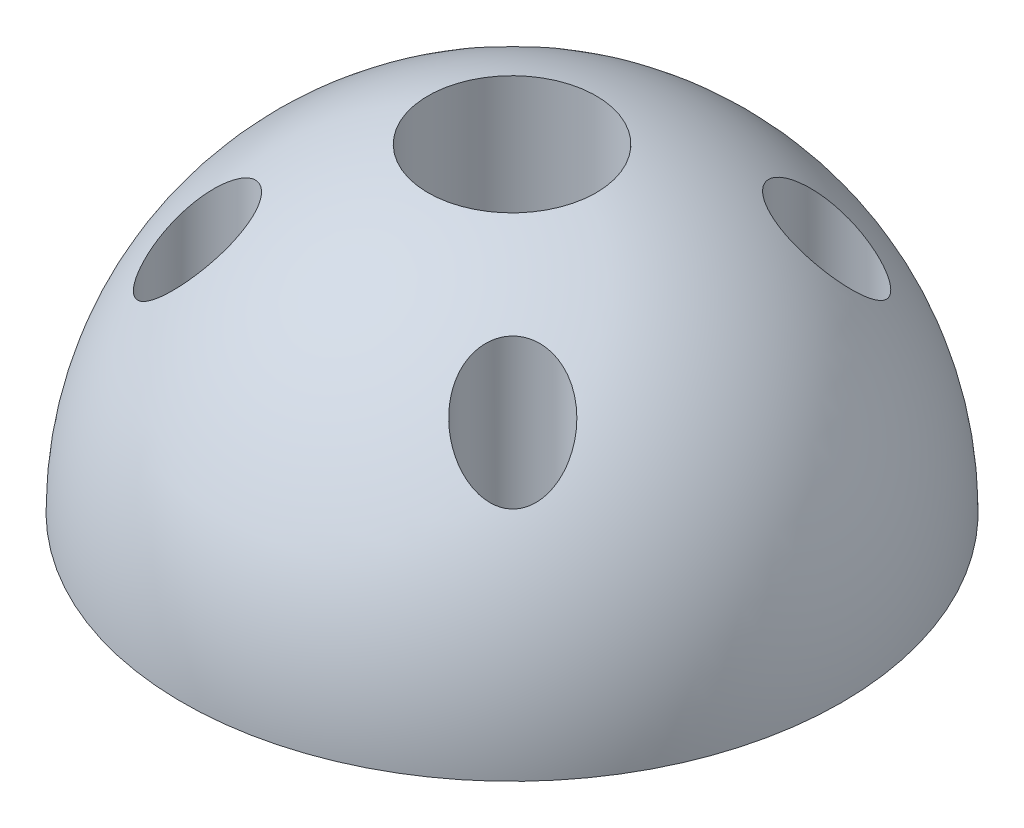
from build123d import *

# Parameters (mm, degrees)
CUT_EXTRUDE2_DEPTH = 3.5
SKETCH7_R          = 1.5
CUT_EXTRUDE6_DEPTH = 7
SKETCH3_R          = 5.1
CUT_EXTRUDE7_DEPTH = 33.74522866
CUT_EXTRUDE8_START = 4
SKETCH8_R          = 2.75
CUT_EXTRUDE8_DEPTH = 31.263537471


with BuildPart() as part:
    # Sketch1 → Revolve1 (revolve)
    with BuildSketch(Plane.XY):
        with BuildLine():
            ThreePointArc((0, 20), (-14.142135624, 14.142135624), (-20, 0))
            Line((-20, 0), (0, 0))
            Line((0, 0), (0, 20))
        make_face()
    revolve(axis=Axis((0, -1000, 0), (0, 1, 0)))

    # Sketch2 → Cut-Extrude2 (cut)
    with BuildSketch(Plane.XZ):
        Polygon((4.878609775, -8.45), (9.757219549, 0), (4.878609775, 8.45), (-4.878609775, 8.45), (-9.757219549, 0), (-4.878609775, -8.45), align=None)
    extrude(amount=-CUT_EXTRUDE2_DEPTH, mode=Mode.SUBTRACT)

    # Sketch7 → Cut-Extrude6 (cut)
    with BuildSketch(Plane.XZ):
        with Locations((-9.545941546, 9.545941546)):
            Circle(SKETCH7_R)
        with Locations((9.524342497, 9.524342497)):
            Circle(SKETCH7_R)
        with Locations((9.502743447, -9.545941546)):
            Circle(SKETCH7_R)
        with Locations((-9.567540595, -9.524342497)):
            Circle(SKETCH7_R)
    extrude(amount=-CUT_EXTRUDE6_DEPTH, mode=Mode.SUBTRACT)

    # Sketch3 → Cut-Extrude7 (cut, through all)
    with BuildSketch(Plane.XZ.offset(-3.5)):
        Circle(SKETCH3_R)
    extrude(amount=-CUT_EXTRUDE7_DEPTH, mode=Mode.SUBTRACT)

    # Sketch8 → Cut-Extrude8 (cut, through all)
    with BuildSketch(Plane(origin=(0, 0, 0), x_dir=(1, 0, 0), z_dir=(0, 1, 0)).offset(CUT_EXTRUDE8_START)):
        with Locations((-9.567540595, 9.524342497)):
            Circle(SKETCH8_R)
        with Locations((9.524342497, 9.567540595)):
            Circle(SKETCH8_R)
        with Locations((9.567540595, -9.524342497)):
            Circle(SKETCH8_R)
        with Locations((-9.524342497, -9.567540595)):
            Circle(SKETCH8_R)
    extrude(amount=CUT_EXTRUDE8_DEPTH, mode=Mode.SUBTRACT)


solid = part.part
